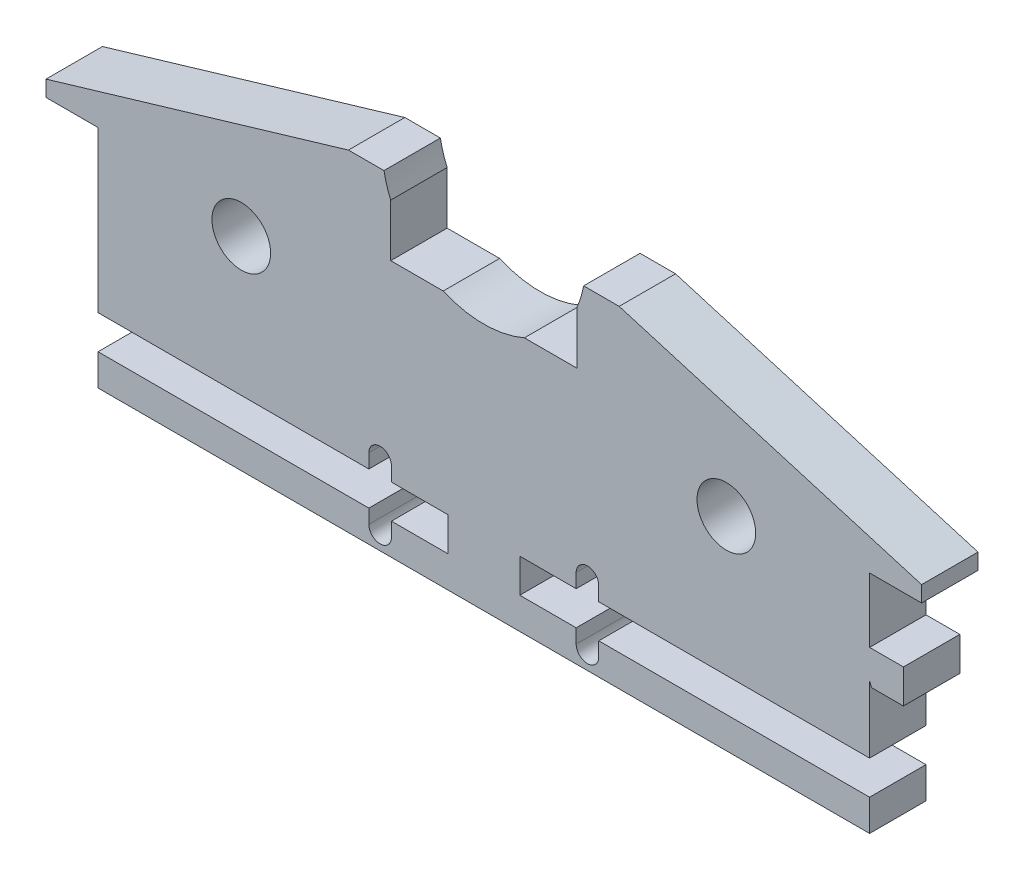
from build123d import *

# Parameters (mm, degrees)
SKETCH1_R           = 2.6
BOSS_EXTRUDE1_DEPTH = 5


with BuildPart() as part:
    # Sketch1 → Boss-Extrude1 (new body)
    with BuildSketch(Plane.XY):
        with BuildLine():
            Line((21.38888677, -10.201493875), (21.38888677, -7.201493875))
            Line((21.38888677, -7.201493875), (21.38888677, -6.773006993))
            Line((21.38888677, -6.773006993), (21.561770683, -7.201493875))
            Line((21.561770683, -7.201493875), (24.38888677, -7.201493875))
            Line((24.38888677, -7.201493875), (24.38888677, -4.201493875))
            Line((24.38888677, -4.201493875), (21.38888677, -4.201493875))
            Line((21.38888677, -4.201493875), (21.38888677, 1.512749566))
            Line((21.38888677, 1.512749566), (26, 1.512749566))
            Line((26, 1.512749566), (26, 2.924352213))
            Line((26, 2.924352213), (-0.810115609, 10.881068786))
            Line((-0.810115609, 10.881068786), (-3.959261535, 10.881068786))
            ThreePointArc((-3.959261535, 10.881068786), (-4.203414832, 9.881266763), (-4.560115609, 8.915875923))
            Line((-4.560115609, 8.915875923), (-4.560115609, 4.262749566))
            Line((-4.560115609, 4.262749566), (-9.213241966, 4.262749566))
            ThreePointArc((-9.213241966, 4.262749566), (-12.810115609, 3.512749566), (-16.406989251, 4.262749566))
            Line((-16.406989251, 4.262749566), (-21.060115609, 4.262749566))
            Line((-21.060115609, 4.262749566), (-21.060115609, 8.915875923))
            ThreePointArc((-21.060115609, 8.915875923), (-21.416816385, 9.881266763), (-21.660969682, 10.881068786))
            Line((-21.660969682, 10.881068786), (-24.810115609, 10.881068786))
            Line((-24.810115609, 10.881068786), (-51.620231217, 2.924352213))
            Line((-51.620231217, 2.924352213), (-51.620231217, 1.512749566))
            Line((-51.620231217, 1.512749566), (-47.009117987, 1.512749566))
            Line((-47.009117987, 1.512749566), (-47.009117987, -6.773006993))
            Line((-47.009117987, -6.773006993), (-47.009117987, -10.201493875))
            Line((-47.009117987, -10.201493875), (-47.009117987, -12.701493875))
            Line((-47.009117987, -12.701493875), (-23, -12.701493875))
            Line((-23, -12.701493875), (-23, -11.451493875))
            ThreePointArc((-23, -11.451493875), (-22, -10.451493875), (-21, -11.451493875))
            Line((-21, -11.451493875), (-21, -12.701493875))
            Line((-21, -12.701493875), (-16, -12.701493875))
            Line((-16, -12.701493875), (-16, -15.701493875))
            Line((-16, -15.701493875), (-21, -15.701493875))
            Line((-21, -15.701493875), (-21, -16.951493875))
            ThreePointArc((-21, -16.951493875), (-22, -17.951493875), (-23, -16.951493875))
            Line((-23, -16.951493875), (-23, -15.701493875))
            Line((-23, -15.701493875), (-47.009117987, -15.701493875))
            Line((-47.009117987, -15.701493875), (-47.009117987, -18.487250434))
            Line((-47.009117987, -18.487250434), (21.38888677, -18.487250434))
            Line((21.38888677, -18.487250434), (21.38888677, -15.701493875))
            Line((21.38888677, -15.701493875), (-2.620231217, -15.701493875))
            Line((-2.620231217, -15.701493875), (-2.620231217, -16.951493875))
            ThreePointArc((-2.620231217, -16.951493875), (-3.620231217, -17.951493875), (-4.620231217, -16.951493875))
            Line((-4.620231217, -16.951493875), (-4.620231217, -15.701493875))
            Line((-4.620231217, -15.701493875), (-9.620231217, -15.701493875))
            Line((-9.620231217, -15.701493875), (-9.620231217, -12.701493875))
            Line((-9.620231217, -12.701493875), (-4.620231217, -12.701493875))
            Line((-4.620231217, -12.701493875), (-4.620231217, -11.451493875))
            ThreePointArc((-4.620231217, -11.451493875), (-3.620231217, -10.451493875), (-2.620231217, -11.451493875))
            Line((-2.620231217, -11.451493875), (-2.620231217, -12.701493875))
            Line((-2.620231217, -12.701493875), (21.38888677, -12.701493875))
            Line((21.38888677, -12.701493875), (21.38888677, -10.201493875))
        make_face()
        with Locations((-34.310115609, -0.487250434)):
            Circle(SKETCH1_R, mode=Mode.SUBTRACT)
        with Locations((8.689884391, -0.487250434)):
            Circle(SKETCH1_R, mode=Mode.SUBTRACT)
    extrude(amount=BOSS_EXTRUDE1_DEPTH)


solid = part.part
